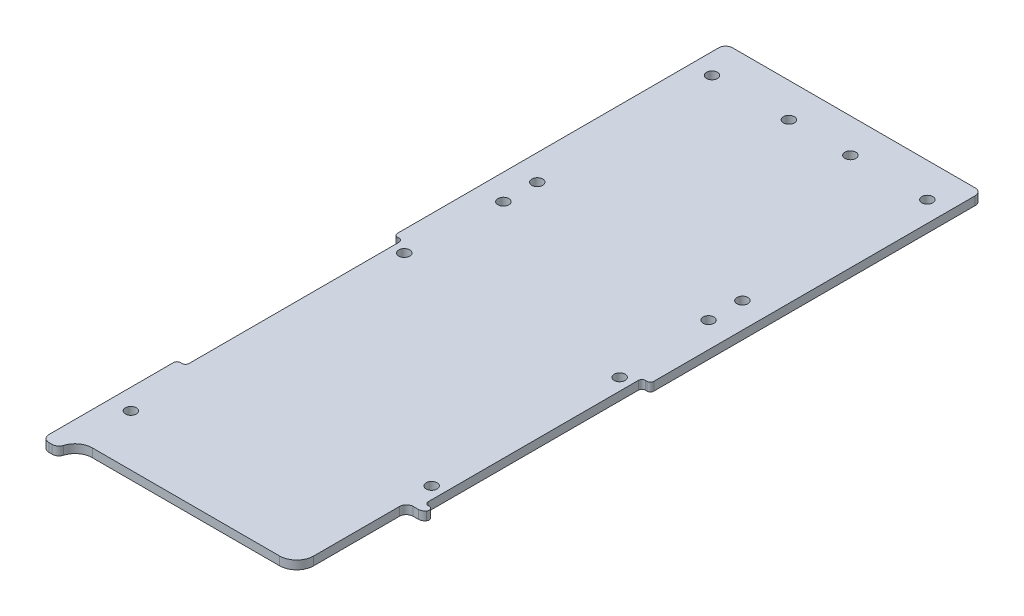
from build123d import *

# Parameters (mm, degrees)
SKETCH1_R               = 2.032
BOSS_EXTRUDE1_DEPTH     = 3.175
FILLET1_R               = 2.54
FILLET2_R               = 2.54
FILLET3_R               = 6.35
CUT_EXTRUDE1_DEPTH      = 136.673215063
FILLET4_R               = 6.35
FILLET5_R               = 2.54
SKETCH3_R               = 2.032
CUT_EXTRUDE2_DEPTH      = 136.673215063
CUT_EXTRUDE3_DEPTH      = 136.673215063
CUT_EXTRUDE3_DEPTH_BACK = 136.673215063
SKETCH4_W               = 3.175
SKETCH4_H               = 80.645
FILLET6_R               = 1.27


with BuildPart() as part:
    # Sketch1 → Boss-Extrude1 (new body)
    with BuildSketch(Plane(origin=(0, 0, 0), x_dir=(1, 0, 0), z_dir=(0, 1, 0))):
        Polygon((47.625, 127), (-47.625, 127), (-47.625, -127), (-41.275, -127), (-41.275, -120.65), (41.275, -120.65), (41.275, -127), (47.625, -127), align=None)
        with Locations((-39.999684148, -101.6)):
            Circle(SKETCH1_R, mode=Mode.SUBTRACT)
        with Locations((39.999684148, -69.85)):
            Circle(SKETCH1_R, mode=Mode.SUBTRACT)
        with Locations((-39.999684148, 0)):
            Circle(SKETCH1_R, mode=Mode.SUBTRACT)
        with Locations((-39.999684148, 114.3)):
            Circle(SKETCH1_R, mode=Mode.SUBTRACT)
        with Locations((-11.424684148, 114.3)):
            Circle(SKETCH1_R, mode=Mode.SUBTRACT)
        with Locations((39.999684148, 0)):
            Circle(SKETCH1_R, mode=Mode.SUBTRACT)
        with Locations((11.424684148, 114.3)):
            Circle(SKETCH1_R, mode=Mode.SUBTRACT)
        with Locations((39.999684148, 114.3)):
            Circle(SKETCH1_R, mode=Mode.SUBTRACT)
    extrude(amount=BOSS_EXTRUDE1_DEPTH)

    # Fillet1
    fillet1_edges = [part.edges().sort_by_distance(p)[0] for p in [
        (-47.625, 1.5875, -127),
        (47.625, 1.5875, -127),
        (47.625, 1.5875, 127),
        (-47.625, 1.5875, 127),
    ]]
    fillet(fillet1_edges, radius=FILLET1_R)

    # Fillet2
    fillet2_edges = [part.edges().sort_by_distance(p)[0] for p in [
        (41.275, 1.5875, 127),
        (-41.275, 1.5875, 127),
    ]]
    fillet(fillet2_edges, radius=FILLET2_R)

    # Fillet3
    fillet3_edges = [part.edges().sort_by_distance(p)[0] for p in [
        (41.275, 1.5875, 120.65),
        (-41.275, 1.5875, 120.65),
    ]]
    fillet(fillet3_edges, radius=FILLET3_R)

    # Sketch2 → Cut-Extrude1 (cut, through all)
    with BuildSketch(Plane.XZ):
        with BuildLine():
            Line((40.64508, 123.578690235), (40.64508, 79.88808))
            Line((40.64508, 79.88808), (47.625, 79.88808))
            Line((47.625, 79.88808), (47.625, 124.46))
            ThreePointArc((47.625, 124.46), (46.881051224, 126.256051224), (45.085, 127))
            Line((45.085, 127), (43.815, 127))
            ThreePointArc((43.815, 127), (42.297059666, 126.496530663), (41.380880287, 125.185714286))
            ThreePointArc((41.380880287, 125.185714286), (41.069166069, 124.356476684), (40.64508, 123.578690235))
        make_face()
    extrude(amount=-CUT_EXTRUDE1_DEPTH, mode=Mode.SUBTRACT)

    # Fillet4
    fillet4_edges = [part.edges().sort_by_distance(p)[0] for p in [
        (40.64508, 1.5875, 123.578690235),
    ]]
    fillet(fillet4_edges, radius=FILLET4_R)

    # Fillet5
    fillet5_edges = [part.edges().sort_by_distance(p)[0] for p in [
        (47.625, 1.5875, 79.88808),
        (40.64508, 1.5875, 79.88808),
    ]]
    fillet(fillet5_edges, radius=FILLET5_R)

    # Sketch3 → Cut-Extrude2 (cut, through all)
    with BuildSketch(Plane.XZ):
        with Locations((-38.10558422, -34.913768806)):
            Circle(SKETCH3_R)
        with Locations((-38.10558422, -47.490173279)):
            Circle(SKETCH3_R)
        with Locations((38.10558422, -47.490173279)):
            Circle(SKETCH3_R)
        with Locations((38.10558422, -34.913768806)):
            Circle(SKETCH3_R)
    extrude(amount=-CUT_EXTRUDE2_DEPTH, mode=Mode.SUBTRACT)

    # Sketch4 → Cut-Extrude3 (cut, two sides: drawn at the far end of the back side and taken through both)
    with BuildSketch(Plane(origin=(0, 3.175, 0), x_dir=(1, 0, 0), z_dir=(0, 1, 0)).offset(-CUT_EXTRUDE3_DEPTH_BACK)):
        with Locations((-46.0375, -36.5125)):
            Rectangle(SKETCH4_W, SKETCH4_H)
        with Locations((46.0375, -36.5125)):
            Rectangle(SKETCH4_W, SKETCH4_H)
    extrude(amount=CUT_EXTRUDE3_DEPTH + CUT_EXTRUDE3_DEPTH_BACK, mode=Mode.SUBTRACT)

    # Fillet6
    fillet6_edges = [part.edges().sort_by_distance(p)[0] for p in [
        (-44.45, 1.5875, -3.81),
        (-47.625, 1.5875, -3.81),
        (-47.625, 1.5875, 76.835),
        (-44.45, 1.5875, 76.835),
        (44.45, 1.5875, 76.835),
        (47.625, 1.5875, 76.835),
        (44.45, 1.5875, -3.81),
        (47.625, 1.5875, -3.81),
    ]]
    fillet(fillet6_edges, radius=FILLET6_R)


solid = part.part
